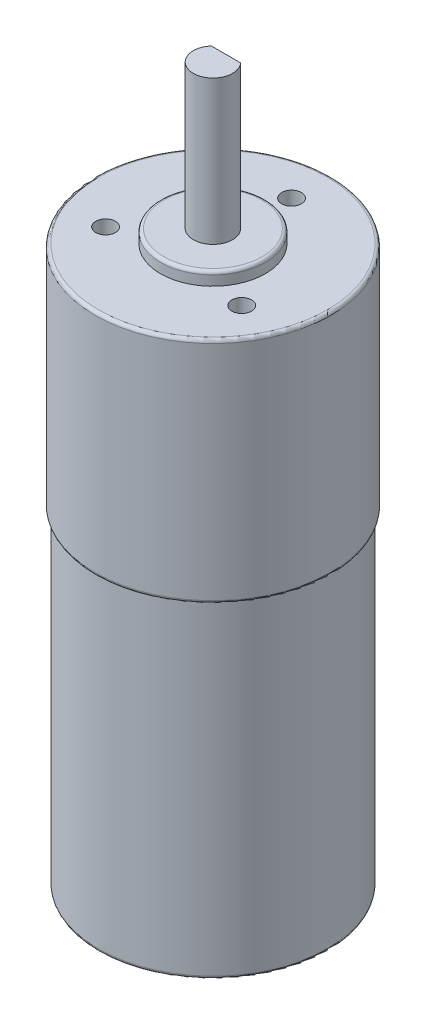
from build123d import *

# Parameters (mm, degrees)
SKETCH_1_R          = 17.5
EXTRUDE_1_DEPTH     = 50
SKETCH_3_R          = 18
EXTRUDE_4_DEPTH     = 35
SKETCH_4_R          = 8
EXTRUDE_5_DEPTH     = 2
SKETCH_5_R          = 3
EXTRUDE_6_DEPTH     = 22
SKETCH_6_R          = 1.5
CUT_EXTRUDE_1_DEPTH = 5
SKETCH_7_W          = 8.061647896
SKETCH_7_H          = 1.71902786
CUT_EXTRUDE_2_DEPTH = 18
FILLET_10_R         = 0.5
FILLET_11_R         = 0.5
FILLET_12_R         = 0.5
FILLET_13_R         = 0.5


with BuildPart() as part:
    # 草图1 → 凸台-拉伸1 (new body)
    with BuildSketch(Plane(origin=(0, 0, 0), x_dir=(1, 0, 0), z_dir=(0, 1, 0))):
        with Locations(Location((0, 0, 0), (0, 0, 270))):
            Circle(SKETCH_1_R)
    extrude(amount=EXTRUDE_1_DEPTH)

    # 草图3 → 凸台-拉伸4 (add)
    with BuildSketch(Plane(origin=(0, 50, 0), x_dir=(1, 0, 0), z_dir=(0, 1, 0))):
        with Locations(Location((0, 0, 0), (0, 0, 270))):
            Circle(SKETCH_3_R)
    extrude(amount=EXTRUDE_4_DEPTH)

    # 草图4 → 凸台-拉伸5 (add)
    with BuildSketch(Plane(origin=(0, 85, 0), x_dir=(1, 0, 0), z_dir=(0, 1, 0))):
        with Locations(Location((0, 0, 0), (0, 0, 270))):
            Circle(SKETCH_4_R)
    extrude(amount=EXTRUDE_5_DEPTH)

    # 草图5 → 凸台-拉伸6 (add)
    with BuildSketch(Plane(origin=(0, 87, 0), x_dir=(1, 0, 0), z_dir=(0, 1, 0))):
        with Locations(Location((0, 0, 0), (0, 0, 270))):
            Circle(SKETCH_5_R)
    extrude(amount=EXTRUDE_6_DEPTH)

    # 草图6 → 切除-拉伸1 (cut)
    with BuildSketch(Plane(origin=(0, 85, 0), x_dir=(1, 0, 0), z_dir=(0, 1, 0))):
        with Locations(Location((0, 12, 0), (0, 0, 270))):
            Circle(SKETCH_6_R)
        with Locations(Location((10.392304845, -6, 0), (0, 0, 270))):
            Circle(SKETCH_6_R)
        with Locations(Location((-10.392304845, -6, 0), (0, 0, 270))):
            Circle(SKETCH_6_R)
    extrude(amount=-CUT_EXTRUDE_1_DEPTH, mode=Mode.SUBTRACT)

    # 草图7 → 切除-拉伸2 (cut)
    with BuildSketch(Plane(origin=(0, 109, 0), x_dir=(1, 0, 0), z_dir=(0, 1, 0))):
        with Locations((-0.414937759, 2.85951393)):
            Rectangle(SKETCH_7_W, SKETCH_7_H)
    extrude(amount=-CUT_EXTRUDE_2_DEPTH, mode=Mode.SUBTRACT)

    # 圆角10
    fillet_10_edges = [part.edges().sort_by_distance(p)[0] for p in [
        (0, 85, -18),
    ]]
    fillet(fillet_10_edges, radius=FILLET_10_R)

    # 圆角11
    fillet_11_edges = [part.edges().sort_by_distance(p)[0] for p in [
        (0, 50, -18),
    ]]
    fillet(fillet_11_edges, radius=FILLET_11_R - 0.0001)  # a hair under: the kernel refuses the full size

    # 圆角12
    fillet_12_edges = [part.edges().sort_by_distance(p)[0] for p in [
        (0, 0, -17.5),
    ]]
    fillet(fillet_12_edges, radius=FILLET_12_R)

    # 圆角13
    fillet_13_edges = [part.edges().sort_by_distance(p)[0] for p in [
        (0, 87, -8),
    ]]
    fillet(fillet_13_edges, radius=FILLET_13_R)


solid = part.part
